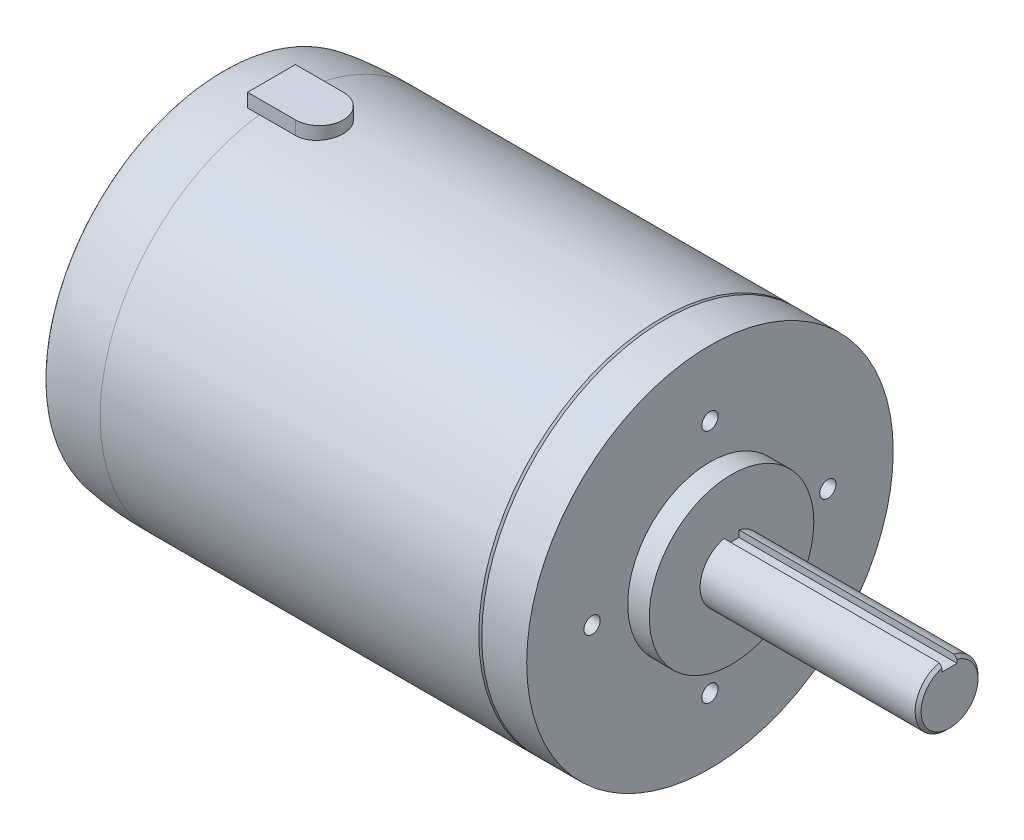
from build123d import *

# Parameters (mm, degrees)
FILLET1_SIZE              = 1.27
FILLET1_SIZE_2            = 12.7
SKETCH3_W                 = 3.175
SKETCH3_H                 = 3.175
CUT_EXTRUDE1_DEPTH        = 46.228
F_4_40_TAPPED_HOLE1_D     = 2.2606
F_4_40_TAPPED_HOLE1_DEPTH = 7.62
F_4_40_TAPPED_HOLE1_TIP   = 0.679152758
CIRPATTERN1_COUNT         = 4
BOSS_EXTRUDE1_DEPTH       = 41.402


# Read off the part's stored shape, not the designer's step: #6-32 Tapped Hole1
with BuildPart() as part:
    # Sketch2 → Revolve1 (revolve)
    with BuildSketch(Plane.XY, mode=Mode.PRIVATE) as revolve1_sk:
        Polygon((50.8, 0), (-115.824, 0), (-115.824, 4.7625), (-103.124, 4.7625), (-103.124, 38.862), (-10.16, 38.862), (-9.525, 38.227), (-9.525, 38.862), (0, 38.862), (0, 17.4498), (4.572, 17.4498), (4.572, 6.6675), (50.165, 6.6675), (50.8, 6.0325), align=None)
    revolve(revolve1_sk.sketch.rotate(Axis((88.99, 0, 0), (-1, 0, 0)), 90), axis=Axis((88.99, 0, 0), (-1, 0, 0)))

    # Fillet1
    # an asymmetric fillet: 12.7, 1.27 mm, written as the material it takes off along each edge
    with BuildSketch(Plane(origin=(-103.124, 0, 0), x_dir=(0, 0, -1), z_dir=(0, 1, 0))) as fillet1_piece_1:
        with BuildLine():
            Bezier((38.862 - FILLET1_SIZE, 0), (38.862, 0), (38.862, -FILLET1_SIZE_2), weights=[1, 0.707106781, 1])
            Line((38.862, -FILLET1_SIZE_2), (38.862, 0))
            Line((38.862, 0), (38.862 - FILLET1_SIZE, 0))
        make_face()
    revolve(axis=Axis((-103.124, 0, 0), (-1, 0, 0)), mode=Mode.SUBTRACT)

    # Sketch3 → Cut-Extrude1 (cut)
    with BuildSketch(Plane(origin=(50.8, 0, 0), x_dir=(0, 0, -1), z_dir=(1, 0, 0))):
        with Locations((0, 6.6675)):
            Rectangle(SKETCH3_W, SKETCH3_H)
    extrude(amount=-CUT_EXTRUDE1_DEPTH, mode=Mode.SUBTRACT)

    # Sketch8 → #8-32 Tapped Hole3 (revolve, cut)
    with BuildSketch(Plane(origin=(0, 0, -25), x_dir=(0, 0, -1), z_dir=(0, 1, 0))):
        Polygon((0, 0), (0, 11.705806461), (1.7272, 10.668), (1.7272, 0), align=None)
    f_8_32_tapped_hole3 = revolve(axis=Axis((6.35, 0, -25), (-1, 0, 0)), mode=Mode.SUBTRACT)

    # #6-32 Tapped Hole1 outline → #6-32 Tapped Hole1 (revolve, cut)
    with BuildSketch(Plane(origin=(0, 19.813624417, 28.296788218), x_dir=(0, 1, 0), z_dir=(0, 0, -1))):
        Polygon((1.35255, -93.726), (0, -92.91330597), (0, -103.124), (1.35255, -103.124), align=None)
    f_6_32_tapped_hole1 = revolve(axis=Axis((0, 19.813624417, 28.296788218), (1, 0, 0)), mode=Mode.SUBTRACT)

    # #4-40 Tapped Hole1
    with Locations(Plane.ZY.offset(103.124)):
        with Locations((-23, 0), (23, 0)):
            Hole(F_4_40_TAPPED_HOLE1_D / 2, depth=F_4_40_TAPPED_HOLE1_DEPTH)
            with Locations((0, 0, -(F_4_40_TAPPED_HOLE1_DEPTH + F_4_40_TAPPED_HOLE1_TIP / 2))):  # 118° drill point
                Cone(0, F_4_40_TAPPED_HOLE1_D / 2, F_4_40_TAPPED_HOLE1_TIP, mode=Mode.SUBTRACT)

    # CirPattern1: #8-32 Tapped Hole3, #6-32 Tapped Hole1 ×4 about axis
    cirpattern1_axis = Axis((0, 0, 0), (1, 0, 0))
    add([f_8_32_tapped_hole3.rotate(cirpattern1_axis, i * 360 / CIRPATTERN1_COUNT) for i in range(1, CIRPATTERN1_COUNT)], mode=Mode.SUBTRACT)
    add([f_6_32_tapped_hole1.rotate(cirpattern1_axis, i * 360 / CIRPATTERN1_COUNT) for i in range(1, CIRPATTERN1_COUNT)], mode=Mode.SUBTRACT)

    # Sketch12 → Boss-Extrude1 (add)
    with BuildSketch(Plane(origin=(0, 0, 0), x_dir=(1, 0, 0), z_dir=(0, 1, 0))):
        with BuildLine():
            Line((-92.964, -5.08), (-82.804, -5.08))
            ThreePointArc((-82.804, -5.08), (-77.724, 0), (-82.804, 5.08))
            Line((-82.804, 5.08), (-92.964, 5.08))
            Line((-92.964, 5.08), (-92.964, -5.08))
        make_face()
    extrude(amount=BOSS_EXTRUDE1_DEPTH)


solid = part.part
